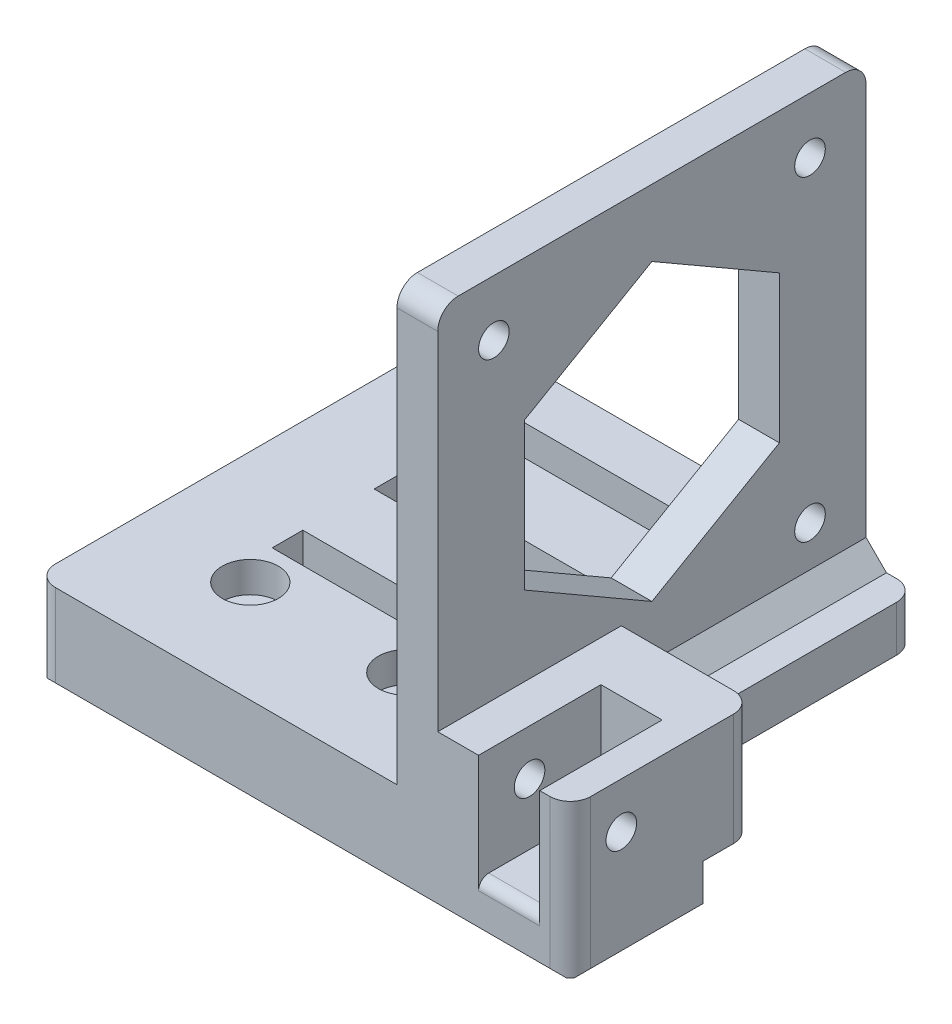
from build123d import *

# Parameters (mm, degrees)
EXTRUDE_1_DEPTH           = 5
SKETCH_3_W                = 4
SKETCH_3_H                = 42
EXTRUDE_2_DEPTH           = 42
SKETCH_4_R                = 1.5
CUT_EXTRUDE_1_DEPTH       = 42.5
SKETCH_5_R                = 12.5
CUT_EXTRUDE_2_DEPTH       = 42.5
SKETCH_7_W                = 20
SKETCH_7_H                = 5
EXTRUDE_3_DEPTH           = 5
EXTRUDE_5_DEPTH           = 42
SKETCH_11_W               = 20
SKETCH_11_H               = 5
EXTRUDE_6_DEPTH           = 18
SKETCH_12_W               = 4
SKETCH_12_H               = 20
EXTRUDE_7_DEPTH           = 42
CUT_EXTRUDE_4_REACH       = 106.221
SKETCH_13_R               = 1.6
CUT_EXTRUDE_START         = -22
SKETCH_15_W               = 10
SKETCH_15_H               = 27
CUT_EXTRUDE_5_DEPTH       = 22
SKETCH_16_W               = 5
SKETCH_16_H               = 5
CUT_EXTRUDE_6_DEPTH       = 42
EXTRUDE_START             = -22
SKETCH_17_W               = 10
SKETCH_17_H               = 5
EXTRUDE_8_DEPTH           = 22
CUT_EXTRUDE_7_DEPTH       = 5
CHAMFER_1_SIZE            = 7
EXTRUDE_10_REACH          = 103.064
SKETCH_28_W               = 5
SKETCH_28_H               = 10
SKETCH_29_W               = 10
SKETCH_29_H               = 13
SKETCH_29_W_2             = 33
EXTRUDE_11_DEPTH          = 3
EXTRUDE_12_DEPTH          = 10
EXTRUDE_13_DEPTH          = 10
CUT_EXTRUDE_8_DEPTH       = 10
EXTRUDE_14_REACH          = 91.118
SKETCH_34_R               = 3
CUT_EXTRUDE_9_DEPTH       = 3
SKETCH_35_R               = 1.5
CUT_EXTRUDE_10_DEPTH      = 104.334408597
SKETCH_37_W               = 25
SKETCH_37_H               = 3.734653936
CUT_EXTRUDE_11_DEPTH      = 103.063705596
EXTRUDE_15_DEPTH          = 5
CUT_EXTRUDE_12_DEPTH      = 5
SKETCH_40_W               = 19
SKETCH_40_H               = 5
CUT_EXTRUDE_13_DEPTH      = 42
SKETCH_41_W               = 19
SKETCH_41_H               = 5
CUT_EXTRUDE_14_DEPTH      = 42
EXTRUDE_16_DEPTH          = 5
EXTRUDE_17_DEPTH          = 5
SKETCH_44_R               = 1.6
CUT_EXTRUDE_15_DEPTH      = 97.446876569
CUT_EXTRUDE_16_DEPTH      = 20
EXTRUDE_18_REACH          = 88.155
SKETCH_46_W               = 25
SKETCH_46_H               = 5
SKETCH_48_W               = 46
SKETCH_48_H               = 42
CUT_EXTRUDE_17_DEPTH      = 0.5
SKETCH_49_W               = 42
SKETCH_49_H               = 4.5
CUT_EXTRUDE_18_DEPTH      = 10.5
SKETCH_50_W               = 42
SKETCH_50_H               = 4.5
EXTRUDE_19_DEPTH          = 49.5
SKETCH_52_W               = 21.14986069
SKETCH_52_H               = 3
CUT_EXTRUDE_19_DEPTH      = 93.033961123
SKETCH_53_W               = 49.5
SKETCH_53_H               = 13
EXTRUDE_21_DEPTH          = 4
CUT_EXTRUDE_20_DEPTH      = 5
SKETCH_55_R               = 2.75
CUT_EXTRUDE_21_DEPTH      = 3
SKETCH_56_R               = 1.5
CUT_EXTRUDE_22_DEPTH      = 90.77332566
SKETCH_57_W               = 13
SKETCH_57_H               = 8.5
EXTRUDE_22_DEPTH          = 5
SKETCH_61_W               = 13
SKETCH_61_H               = 8.5
EXTRUDE_25_DEPTH          = 3
SKETCH_64_W               = 8
SKETCH_64_H               = 4.5
EXTRUDE_26_DEPTH          = 5
EXTRUDE_27_DEPTH          = 5
CUT_EXTRUDE_23_DEPTH      = 95.335836245
CUT_EXTRUDE_23_DEPTH_BACK = 4
SKETCH_62_W               = 6
SKETCH_62_H               = 12
FILLET_2_R                = 1
SKETCH_63_R               = 1.5
CUT_EXTRUDE_24_DEPTH      = 12
SKETCH_66_R               = 1.5
EXTRUDE_28_DEPTH          = 4
CHAMFER_2_SIZE            = 0.4
FILLET_3_R                = 2
EXTRUDE_29_DEPTH          = 24
FILLET_4_R                = 2
CUT_EXTRUDE_START_2       = -4.000001
CUT_EXTRUDE_25_DEPTH      = 4.000002
EXTRUDE_30_DEPTH          = 1.5


# Some blends are built 0.0001 mm under size
with BuildPart() as part:
    # 草图1 → 凸台-拉伸1 (new body)
    with BuildSketch(Plane(origin=(0, 0, 0), x_dir=(1, 0, 0), z_dir=(0, 1, 0))):
        Polygon((10, 0), (50, 0), (50, -20), (60, -20), (60, 0), (60, 42), (0, 42), (0, 0), (0, -20), (10, -20), align=None)
    extrude(amount=EXTRUDE_1_DEPTH)

    # 草图3 → 凸台-拉伸2 (add)
    with BuildSketch(Plane(origin=(0, 5, 0), x_dir=(1, 0, 0), z_dir=(0, 1, 0))):
        with Locations((58, 21)):
            Rectangle(SKETCH_3_W, SKETCH_3_H)
    extrude(amount=EXTRUDE_2_DEPTH)

    # 草图4 → 切除-拉伸1 (cut)
    with BuildSketch(Plane.ZY.offset(-56)):
        with Locations((-36.5, 41.5)):
            Circle(SKETCH_4_R)
        with Locations((-5.5, 41.5)):
            Circle(SKETCH_4_R)
        with Locations((-5.5, 10.5)):
            Circle(SKETCH_4_R)
        with Locations((-36.5, 10.5)):
            Circle(SKETCH_4_R)
    extrude(amount=-CUT_EXTRUDE_1_DEPTH, mode=Mode.SUBTRACT)

    # 草图5 → 切除-拉伸2 (cut)
    with BuildSketch(Plane.ZY.offset(-56)):
        with Locations((-21, 26)):
            Circle(SKETCH_5_R)
    extrude(amount=-CUT_EXTRUDE_2_DEPTH, mode=Mode.SUBTRACT)

    # 草图7 → 凸台-拉伸3 (add)
    with BuildSketch(Plane(origin=(60, 0, 0), x_dir=(0, 0, -1), z_dir=(1, 0, 0))):
        with Locations((-10, 2.5)):
            Rectangle(SKETCH_7_W, SKETCH_7_H)
    extrude(amount=EXTRUDE_3_DEPTH)

    # 草图8 → 凸台-拉伸5 (add)
    with BuildSketch(Plane(origin=(0, 5, 0), x_dir=(1, 0, 0), z_dir=(0, 1, 0))):
        Polygon((65, 0), (56, 0), (56, -5), (61, -5), (61, -15), (56, -15), (56, -20), (65, -20), align=None)
    extrude(amount=EXTRUDE_5_DEPTH)

    # 草图11 → 凸台-拉伸6 (add)
    with BuildSketch(Plane(origin=(65, 0, 0), x_dir=(0, 0, -1), z_dir=(1, 0, 0))):
        with Locations((-10, 2.5)):
            Rectangle(SKETCH_11_W, SKETCH_11_H)
    extrude(amount=EXTRUDE_6_DEPTH)

    # 草图12 → 凸台-拉伸7 (add)
    with BuildSketch(Plane(origin=(0, 5, 0), x_dir=(1, 0, 0), z_dir=(0, 1, 0))):
        with Locations((81, -10)):
            Rectangle(SKETCH_12_W, SKETCH_12_H)
    extrude(amount=EXTRUDE_7_DEPTH)

    # 切除-拉伸4: up to this face of the body (flat: up to its plane)
    cut_extrude_4_end = Plane(part.part.faces().sort_by_distance((61, 26, 10))[0])
    # 草图13 → 切除-拉伸4 (cut, up to the picked face)
    with BuildSketch(Plane(origin=(83, 0, 0), x_dir=(0, 0, -1), z_dir=(1, 0, 0)), mode=Mode.PRIVATE) as cut_extrude_4_sk1:
        with Locations((-10, 37)):
            Circle(SKETCH_13_R)
    cut_extrude_4_tool1 = split(extrude(cut_extrude_4_sk1.sketch, amount=-CUT_EXTRUDE_4_REACH, mode=Mode.PRIVATE), bisect_by=cut_extrude_4_end, keep=Keep.BOTH, mode=Mode.PRIVATE)
    add(cut_extrude_4_tool1.solids().sort_by(Axis((83, 37, 10), (-1, 0, 0)))[0], mode=Mode.SUBTRACT)

    # 草图15 → 切除-拉伸5 (cut)
    with BuildSketch(Plane.ZY.offset(-61).offset(CUT_EXTRUDE_START)):
        with Locations((10, 18.5)):
            Rectangle(SKETCH_15_W, SKETCH_15_H)
    extrude(amount=CUT_EXTRUDE_5_DEPTH, mode=Mode.SUBTRACT)

    # 草图16 → 切除-拉伸6 (cut)
    with BuildSketch(Plane(origin=(0, 47, 0), x_dir=(1, 0, 0), z_dir=(0, 1, 0))):
        with Locations((58.5, -17.5)):
            Rectangle(SKETCH_16_W, SKETCH_16_H)
    extrude(amount=-CUT_EXTRUDE_6_DEPTH, mode=Mode.SUBTRACT)

    # 草图17 → 凸台-拉伸8 (add)
    with BuildSketch(Plane.ZY.offset(-61).offset(EXTRUDE_START)):
        with Locations((10, 7.5)):
            Rectangle(SKETCH_17_W, SKETCH_17_H)
    extrude(amount=EXTRUDE_8_DEPTH)

    # 草图19 → 切除-拉伸7 (cut)
    with BuildSketch(Plane(origin=(0, 10, 0), x_dir=(1, 0, 0), z_dir=(0, 1, 0))):
        Polygon((79, -15), (83, -15), (83, -5), (79, -5), (65, -5), (61, -5), (61, -15), (65, -15), align=None)
    extrude(amount=-CUT_EXTRUDE_7_DEPTH, mode=Mode.SUBTRACT)

    # 倒角1
    chamfer_1_edges = [part.edges().sort_by_distance(p)[0] for p in [
        (79, 5, 2.5),
        (65, 5, 2.5),
    ]]
    chamfer(chamfer_1_edges, length=CHAMFER_1_SIZE - 0.0001)  # a hair under: the kernel refuses the full size

    # 草图28 → 凸台-拉伸10 (add, up to next)
    with BuildSketch(Plane.ZY.offset(-79), mode=Mode.PRIVATE) as extrude_10_sk1:
        with Locations((17.5, 19)):
            Rectangle(SKETCH_28_W, SKETCH_28_H)
    extrude_10_tool1 = extrude(extrude_10_sk1.sketch, amount=EXTRUDE_10_REACH, mode=Mode.PRIVATE) - part.part
    add(extrude_10_tool1.solids().sort_by_distance((79, 19, 17.5))[0])

    # 草图29 → 凸台-拉伸11 (add)
    with BuildSketch(Plane(origin=(0, 0, 0), x_dir=(-1, 0, 0), z_dir=(0, -1, 0))):
        with Locations((-5, -13.5)):
            Rectangle(SKETCH_29_W, SKETCH_29_H)
        with Locations((-66.5, -13.5)):
            Rectangle(SKETCH_29_W_2, SKETCH_29_H)
    extrude(amount=EXTRUDE_11_DEPTH)

    # 草图30 → 凸台-拉伸12 (add)
    with BuildSketch(Plane(origin=(10, 0, 0), x_dir=(0, 0, -1), z_dir=(1, 0, 0))):
        Polygon((-20, 5), (-20, -3), (-7, -3), (-7, 0), (0, 0), (0, 5), align=None)
    extrude(amount=EXTRUDE_12_DEPTH)

    # 草图31 → 凸台-拉伸13 (add)
    with BuildSketch(Plane.ZY.offset(-50)):
        Polygon((0, 0), (7, 0), (7, -3), (20, -3), (20, 5), (0, 5), align=None)
    extrude(amount=EXTRUDE_13_DEPTH)

    # 草图32 → 切除-拉伸8 (cut)
    with BuildSketch(Plane.ZY):
        Polygon((-42, 0), (7, 0), (7, -3), (20, -3), (20, 5), (-42, 5), align=None)
    extrude(amount=-CUT_EXTRUDE_8_DEPTH, mode=Mode.SUBTRACT)

    # 草图33 → 凸台-拉伸14 (add, up to next)
    with BuildSketch(Plane(origin=(20, 0, 0), x_dir=(0, 0, -1), z_dir=(1, 0, 0)), mode=Mode.PRIVATE) as extrude_14_sk1:
        Polygon((0, 5), (-20, 5), (-20, -3), (-7, -3), (-7, 0), (0, 0), align=None)
    extrude_14_tool1 = extrude(extrude_14_sk1.sketch, amount=EXTRUDE_14_REACH, mode=Mode.PRIVATE) - part.part
    add(extrude_14_tool1.solids().sort_by_distance((20, 1.377698, 10.982014))[0])

    # 草图34 → 切除-拉伸9 (cut)
    with BuildSketch(Plane(origin=(0, 5, 0), x_dir=(1, 0, 0), z_dir=(0, 1, 0))):
        with Locations(Location((19.284781786, -10, 0), (0, 0, 270))):
            Circle(SKETCH_34_R)
        with Locations(Location((51.101803391, -10, 0), (0, 0, 270))):
            Circle(SKETCH_34_R)
    extrude(amount=-CUT_EXTRUDE_9_DEPTH, mode=Mode.SUBTRACT)

    # 草图35 → 切除-拉伸10 (cut, through all)
    with BuildSketch(Plane(origin=(0, 2, 0), x_dir=(1, 0, 0), z_dir=(0, 1, 0))):
        with Locations(Location((19.284781786, -10, 0), (0, 0, 270))):
            Circle(SKETCH_35_R)
        with Locations(Location((51.101803391, -10, 0), (0, 0, 270))):
            Circle(SKETCH_35_R)
    extrude(amount=-CUT_EXTRUDE_10_DEPTH, mode=Mode.SUBTRACT)

    # 草图37 → 切除-拉伸11 (cut, through all)
    with BuildSketch(Plane(origin=(0, 5, 0), x_dir=(1, 0, 0), z_dir=(0, 1, 0))):
        with Locations((35.5, 33.696781352)):
            Rectangle(SKETCH_37_W, SKETCH_37_H)
        with Locations((35.5, 23.696781352)):
            Rectangle(SKETCH_37_W, SKETCH_37_H)
        with Locations((35.5, 13.696781352)):
            Rectangle(SKETCH_37_W, SKETCH_37_H)
        with Locations((35.5, 3.696781352)):
            Rectangle(SKETCH_37_W, SKETCH_37_H)
    extrude(amount=-CUT_EXTRUDE_11_DEPTH, mode=Mode.SUBTRACT)

    # 草图38 → 凸台-拉伸15 (add)
    with BuildSketch(Plane.ZY.offset(-61)):
        Polygon((15, 32), (15, 5), (20, 5), (20, 47), (5, 47), (5, 32), align=None)
    extrude(amount=EXTRUDE_15_DEPTH)

    # 草图39 → 切除-拉伸12 (cut)
    with BuildSketch(Plane(origin=(65, 0, 0), x_dir=(0, 0, -1), z_dir=(1, 0, 0))):
        Polygon((-20, 47), (-20, 24), (-15, 24), (-15, 32), (-5, 32), (-5, 12), (0, 12), (0, 47), align=None)
    extrude(amount=-CUT_EXTRUDE_12_DEPTH, mode=Mode.SUBTRACT)

    # 草图40 → 切除-拉伸13 (cut)
    with BuildSketch(Plane(origin=(0, 47, 0), x_dir=(1, 0, 0), z_dir=(0, 1, 0))):
        with Locations((69.5, -2.5)):
            Rectangle(SKETCH_40_W, SKETCH_40_H)
    extrude(amount=-CUT_EXTRUDE_13_DEPTH, mode=Mode.SUBTRACT)

    # 草图41 → 切除-拉伸14 (cut)
    with BuildSketch(Plane(origin=(0, 47, 0), x_dir=(1, 0, 0), z_dir=(0, 1, 0))):
        with Locations((69.5, -17.5)):
            Rectangle(SKETCH_41_W, SKETCH_41_H)
    extrude(amount=-CUT_EXTRUDE_14_DEPTH, mode=Mode.SUBTRACT)

    # 草图42 → 凸台-拉伸16 (add)
    with BuildSketch(Plane.XY.offset(20)):
        Polygon((60, 20), (60, 5), (69.5, 12.5), align=None)
        Polygon((60, 5), (69.5, 5), (79, 5), (69.5, 12.5), align=None)
        Polygon((69.5, 12.5), (79, 5), (79, 20), align=None)
    extrude(amount=-EXTRUDE_16_DEPTH)

    # 草图43 → 凸台-拉伸17 (add)
    with BuildSketch(Plane(origin=(0, 0, 0), x_dir=(-1, 0, 0), z_dir=(0, 0, -1))):
        Polygon((-69.5, 12.5), (-60, 5), (-60, 20), align=None)
        Polygon((-69.5, 12.5), (-79, 5), (-60, 5), align=None)
        Polygon((-79, 20), (-79, 5), (-69.5, 12.5), align=None)
    extrude(amount=-EXTRUDE_17_DEPTH)

    # 草图44 → 切除-拉伸15 (cut, through all)
    with BuildSketch(Plane(origin=(83, 0, 0), x_dir=(0, 0, -1), z_dir=(1, 0, 0))):
        with Locations((-10, 37)):
            Circle(SKETCH_44_R)
    extrude(amount=-CUT_EXTRUDE_15_DEPTH, mode=Mode.SUBTRACT)

    # 草图45 → 切除-拉伸16 (cut)
    with BuildSketch(Plane.XY.offset(20)):
        Polygon((69.5, 12.5), (60, 20), (60, 47), (56, 47), (56, 5), (10, 5), (10, -3), (83, -3), (83, 47), (79, 47), (79, 20), align=None)
    extrude(amount=-CUT_EXTRUDE_16_DEPTH, mode=Mode.SUBTRACT)

    # 草图46 → 凸台-拉伸18 (add, up to next)
    with BuildSketch(Plane(origin=(0, 0, -1.829454384), x_dir=(-1, 0, 0), z_dir=(0, 0, -1)), mode=Mode.PRIVATE) as extrude_18_sk1:
        with Locations((-35.5, 2.5)):
            Rectangle(SKETCH_46_W, SKETCH_46_H)
    extrude_18_tool1 = extrude(extrude_18_sk1.sketch, amount=EXTRUDE_18_REACH, mode=Mode.PRIVATE) - part.part
    add(extrude_18_tool1.solids().sort_by_distance((35.5, 2.5, -1.829454))[0])

    # 草图48 → 切除-拉伸17 (cut)
    with BuildSketch(Plane(origin=(0, 5, 0), x_dir=(1, 0, 0), z_dir=(0, 1, 0))):
        with Locations((33, 21)):
            Rectangle(SKETCH_48_W, SKETCH_48_H)
    extrude(amount=-CUT_EXTRUDE_17_DEPTH, mode=Mode.SUBTRACT)

    # 草图49 → 切除-拉伸18 (cut)
    with BuildSketch(Plane.ZY.offset(-10)):
        with Locations((-21, 2.25)):
            Rectangle(SKETCH_49_W, SKETCH_49_H)
    extrude(amount=-CUT_EXTRUDE_18_DEPTH, mode=Mode.SUBTRACT)

    # 草图50 → 凸台-拉伸19 (add)
    with BuildSketch(Plane.ZY.offset(-20.5)):
        with Locations((-21, 2.25)):
            Rectangle(SKETCH_50_W, SKETCH_50_H)
    extrude(amount=-EXTRUDE_19_DEPTH)

    # 草图52 → 切除-拉伸19 (cut, through all)
    with BuildSketch(Plane(origin=(0, 4.5, 0), x_dir=(1, 0, 0), z_dir=(0, 1, 0))):
        with Locations((40.340210911, 25.5)):
            Rectangle(SKETCH_52_W, SKETCH_52_H)
        with Locations((40.340210911, 35.5)):
            Rectangle(SKETCH_52_W, SKETCH_52_H)
        with Locations((40.340210911, 15.5)):
            Rectangle(SKETCH_52_W, SKETCH_52_H)
    extrude(amount=-CUT_EXTRUDE_19_DEPTH, mode=Mode.SUBTRACT)

    # 草图53 → 凸台-拉伸21 (add)
    with BuildSketch(Plane(origin=(0, 0, 0), x_dir=(-1, 0, 0), z_dir=(0, -1, 0))):
        with Locations((-45.25, 6.5)):
            Rectangle(SKETCH_53_W, SKETCH_53_H)
    extrude(amount=EXTRUDE_21_DEPTH)

    # 草图54 → 切除-拉伸20 (cut)
    with BuildSketch(Plane(origin=(70, 0, 0), x_dir=(0, 0, -1), z_dir=(1, 0, 0))):
        Polygon((42, 0), (42, 4.5), (0, 4.5), (0, -4), (13, -4), (13, 0), align=None)
    extrude(amount=-CUT_EXTRUDE_20_DEPTH, mode=Mode.SUBTRACT)

    # 草图55 → 切除-拉伸21 (cut)
    with BuildSketch(Plane(origin=(0, 4.5, 0), x_dir=(1, 0, 0), z_dir=(0, 1, 0))):
        with Locations(Location((31.617123072, 10, 0), (0, 0, 270))):
            Circle(SKETCH_55_R)
        with Locations(Location((46.91669078, 10, 0), (0, 0, 270))):
            Circle(SKETCH_55_R)
    extrude(amount=-CUT_EXTRUDE_21_DEPTH, mode=Mode.SUBTRACT)

    # 草图56 → 切除-拉伸22 (cut, through all)
    with BuildSketch(Plane(origin=(0, 1.5, 0), x_dir=(1, 0, 0), z_dir=(0, 1, 0))):
        with Locations(Location((31.617123072, 10, 0), (0, 0, 270))):
            Circle(SKETCH_56_R)
        with Locations(Location((46.91669078, 10, 0), (0, 0, 270))):
            Circle(SKETCH_56_R)
    extrude(amount=-CUT_EXTRUDE_22_DEPTH, mode=Mode.SUBTRACT)

    # 草图57 → 凸台-拉伸22 (add)
    with BuildSketch(Plane(origin=(65, 0, 0), x_dir=(0, 0, -1), z_dir=(1, 0, 0))):
        with Locations((6.5, 0.25)):
            Rectangle(SKETCH_57_W, SKETCH_57_H)
    extrude(amount=EXTRUDE_22_DEPTH)

    # 草图61 → 凸台-拉伸25 (add)
    with BuildSketch(Plane(origin=(70, 0, 0), x_dir=(0, 0, -1), z_dir=(1, 0, 0))):
        with Locations((6.5, 0.25)):
            Rectangle(SKETCH_61_W, SKETCH_61_H)
    extrude(amount=EXTRUDE_25_DEPTH)

    # 草图64 → 凸台-拉伸26 (add)
    with BuildSketch(Plane(origin=(0, 0, -13), x_dir=(-1, 0, 0), z_dir=(0, 0, -1))):
        with Locations((-69, 2.25)):
            Rectangle(SKETCH_64_W, SKETCH_64_H)
    extrude(amount=EXTRUDE_26_DEPTH)

    # 草图65 → 凸台-拉伸27 (add)
    with BuildSketch(Plane(origin=(0, 4.5, 0), x_dir=(1, 0, 0), z_dir=(0, 1, 0))):
        Polygon((73, 18), (65, 18), (60, 18), (60, 0), (73, 0), align=None)
    extrude(amount=EXTRUDE_27_DEPTH)

    # 草图62 → 切除-拉伸23 (cut, two sides: drawn at the far end of the back side and taken through both)
    with BuildSketch(Plane(origin=(0, 4.5, 0), x_dir=(1, 0, 0), z_dir=(0, 1, 0)).offset(-CUT_EXTRUDE_23_DEPTH_BACK)):
        with Locations((67, 6)):
            Rectangle(SKETCH_62_W, SKETCH_62_H)
    extrude(amount=CUT_EXTRUDE_23_DEPTH + CUT_EXTRUDE_23_DEPTH_BACK, mode=Mode.SUBTRACT)

    # 圆角2
    fillet_2_edges = [part.edges().sort_by_distance(p)[0] for p in [
        (67, 0.5, 0),
    ]]
    fillet(fillet_2_edges, radius=FILLET_2_R)

    # 草图63 → 切除-拉伸24 (cut)
    with BuildSketch(Plane(origin=(73, 0, 0), x_dir=(0, 0, -1), z_dir=(1, 0, 0))):
        with Locations((5, 6.5)):
            Circle(SKETCH_63_R)
    extrude(amount=-CUT_EXTRUDE_24_DEPTH, mode=Mode.SUBTRACT)

    # 草图66 → 凸台-拉伸28 (add)
    with BuildSketch(Plane.ZY.offset(-56)):
        with Locations((-5.5, 10.5)):
            Circle(SKETCH_66_R)
    extrude(amount=-EXTRUDE_28_DEPTH)

    # 倒角2
    chamfer_2_edges = [part.edges().sort_by_distance(p)[0] for p in [
        (20.5, -4, -6.5),
        (46.75, -4, -13),
        (46.75, -4, 0),
        (31.617123072, -4, -11.5),
        (46.91669078, -4, -11.5),
        (73, -4, -6.5),
    ]]
    chamfer(chamfer_2_edges, length=CHAMFER_2_SIZE)

    # 圆角3
    fillet_3_edges = [part.edges().sort_by_distance(p)[0] for p in [
        (58, 47, -42),
        (58, 47, 0),
        (20.5, 2.25, -42),
        (65, 2.25, -42),
    ]]
    fillet(fillet_3_edges, radius=FILLET_3_R)

    # 草图67 → 凸台-拉伸29 (add)
    with BuildSketch(Plane(origin=(0, 0, -42), x_dir=(-1, 0, 0), z_dir=(0, 0, -1))):
        Polygon((-60, 6.5), (-60, 4.5), (-62, 4.5), align=None)
    extrude(amount=-EXTRUDE_29_DEPTH)

    # 圆角4
    # the kernel refuses this fillet: 2 mm, written as the material it takes off along each edge
    with BuildSketch(Plane(origin=(73, -5, -18), x_dir=(0, 0, 1), z_dir=(0, 1, 0))) as fillet_4_piece_1:
        with BuildLine():
            CenterArc((FILLET_4_R, -FILLET_4_R), FILLET_4_R, 90, 90)
            Line((0, -FILLET_4_R), (0, 0))
            Line((0, 0), (FILLET_4_R, 0))
        make_face()
    extrude(amount=19.5, mode=Mode.SUBTRACT)
    with BuildSketch(Plane(origin=(73, -8.6, 0), x_dir=(-1, 0, 0), z_dir=(0, 1, 0))) as fillet_4_piece_2:
        with BuildLine():
            CenterArc((FILLET_4_R, -FILLET_4_R), FILLET_4_R, 90, 90)
            Line((0, -FILLET_4_R), (0, 0))
            Line((0, 0), (FILLET_4_R, 0))
        make_face()
    extrude(amount=23.1, mode=Mode.SUBTRACT)
    with BuildSketch(Plane(origin=(20.5, 9.5, 0), x_dir=(1, 0, 0), z_dir=(0, -1, 0))) as fillet_4_piece_3:
        with BuildLine():
            CenterArc((FILLET_4_R, -FILLET_4_R), FILLET_4_R, 90, 90)
            Line((0, -FILLET_4_R), (0, 0))
            Line((0, 0), (FILLET_4_R, 0))
        make_face()
    extrude(amount=18.1, mode=Mode.SUBTRACT)

    # 草图68 → 切除-拉伸25 (cut)
    with BuildSketch(Plane(origin=(60, 0, 0), x_dir=(0, 0, -1), z_dir=(1, 0, 0)).offset(CUT_EXTRUDE_START_2)):
        Polygon((21, 40.43375673), (8.5, 33.216878365), (8.5, 18.783121635), (21, 11.56624327), (33.5, 18.783121635), (33.5, 33.216878365), align=None)
    extrude(amount=CUT_EXTRUDE_25_DEPTH, mode=Mode.SUBTRACT)

    # 草图69 → 凸台-拉伸30 (add)
    with BuildSketch(Plane(origin=(0, 9.5, 0), x_dir=(1, 0, 0), z_dir=(0, 1, 0))):
        with BuildLine():
            Line((73, 2), (73, 16))
            ThreePointArc((73, 16), (72.414213562, 17.414213562), (71, 18))
            Line((71, 18), (60, 18))
            Line((60, 18), (60, 0))
            Line((60, 0), (64, 0))
            Line((64, 0), (64, 12))
            Line((64, 12), (70, 12))
            Line((70, 12), (70, 0))
            Line((70, 0), (71, 0))
            ThreePointArc((71, 0), (72.414213562, 0.585786438), (73, 2))
        make_face()
    extrude(amount=EXTRUDE_30_DEPTH)


solid = part.part
